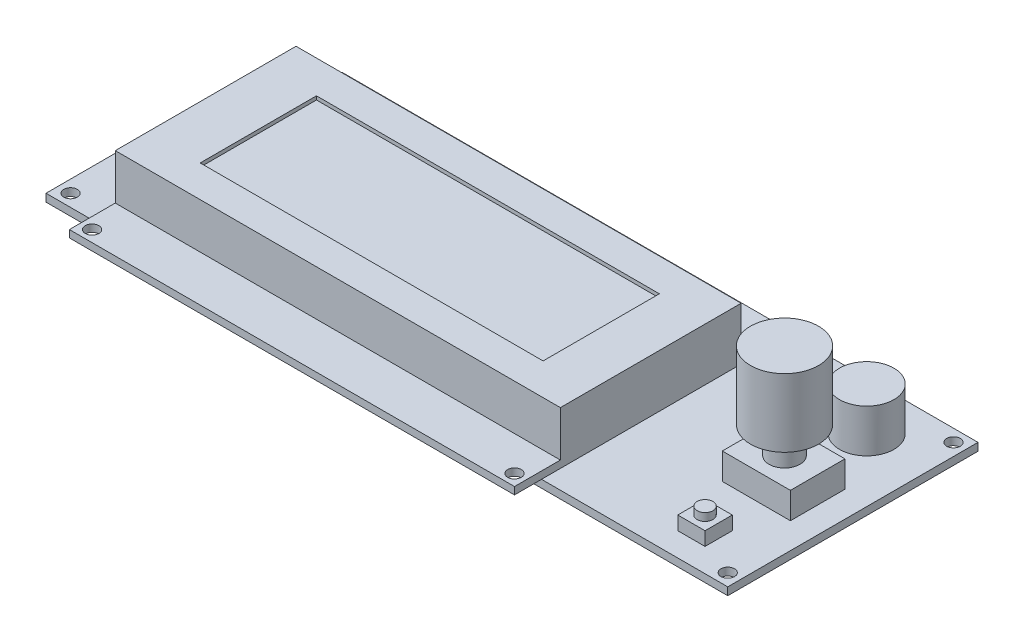
from build123d import *

# Parameters (mm, degrees)
SKETCH1_W            = 150.1
SKETCH1_H            = 55.1
SKETCH1_R            = 1.5
BOSS_EXTRUDE1_DEPTH  = 1.7
SKETCH2_W            = 40.8
SKETCH2_H            = 2.5
BOSS_EXTRUDE2_DEPTH  = 2.4
SKETCH3_W            = 98
SKETCH3_H            = 60
SKETCH3_R            = 1.5
BOSS_EXTRUDE3_DEPTH  = 1.6
SKETCH4_W            = 98
SKETCH4_H            = 39.8
BOSS_EXTRUDE4_DEPTH  = 10
SKETCH5_W            = 75.5
SKETCH5_H            = 25.6
CUT_EXTRUDE1_DEPTH   = 0.8
SKETCH6_R            = 6
BOSS_EXTRUDE5_DEPTH  = 9.5
SKETCH7_W            = 6
SKETCH7_H            = 6
BOSS_EXTRUDE6_DEPTH  = 3
SKETCH8_R            = 1.75
BOSS_EXTRUDE7_DEPTH  = 1.7
SKETCH9_W            = 26.3
SKETCH9_H            = 26.5
BOSS_EXTRUDE8_DEPTH  = 2.8
SKETCH10_W           = 20.2
SKETCH10_H           = 8.6
BOSS_EXTRUDE9_DEPTH  = 9
SKETCH11_R           = 4.65
BOSS_EXTRUDE10_DEPTH = 9
SKETCH12_W           = 15
SKETCH12_H           = 12
BOSS_EXTRUDE11_DEPTH = 5.8
SKETCH13_R           = 3.4
BOSS_EXTRUDE12_DEPTH = 5.9
SKETCH14_R           = 7.5
BOSS_EXTRUDE13_DEPTH = 15


with BuildPart() as part:
    # Sketch1 → Boss-Extrude1 (new body)
    with BuildSketch(Plane(origin=(0, 0, 0), x_dir=(1, 0, 0), z_dir=(0, 1, 0))):
        Rectangle(SKETCH1_W, SKETCH1_H)
        with Locations((-72.35, 24.85)):
            Circle(SKETCH1_R, mode=Mode.SUBTRACT)
        with Locations((-72.35, -24.85)):
            Circle(SKETCH1_R, mode=Mode.SUBTRACT)
        with Locations((72.35, 24.85)):
            Circle(SKETCH1_R, mode=Mode.SUBTRACT)
        with Locations((72.35, -24.85)):
            Circle(SKETCH1_R, mode=Mode.SUBTRACT)
    extrude(amount=BOSS_EXTRUDE1_DEPTH)

    # Sketch2 → Boss-Extrude2 (add)
    with BuildSketch(Plane(origin=(0, 1.7, 0), x_dir=(1, 0, 0), z_dir=(0, 1, 0))):
        with Locations((-32.85, 21.9)):
            Rectangle(SKETCH2_W, SKETCH2_H)
    extrude(amount=BOSS_EXTRUDE2_DEPTH)

    # Sketch3 → Boss-Extrude3 (add)
    with BuildSketch(Plane(origin=(0, 4.1, 0), x_dir=(1, 0, 0), z_dir=(0, 1, 0))):
        with Locations((-12.55, -5.9)):
            Rectangle(SKETCH3_W, SKETCH3_H)
        with Locations((-59.05, 21.6)):
            Circle(SKETCH3_R, mode=Mode.SUBTRACT)
        with Locations((33.95, 21.6)):
            Circle(SKETCH3_R, mode=Mode.SUBTRACT)
        with Locations((33.95, -33.4)):
            Circle(SKETCH3_R, mode=Mode.SUBTRACT)
        with Locations((-59.05, -33.4)):
            Circle(SKETCH3_R, mode=Mode.SUBTRACT)
    extrude(amount=BOSS_EXTRUDE3_DEPTH)

    # Sketch4 → Boss-Extrude4 (add)
    with BuildSketch(Plane(origin=(0, 5.7, 0), x_dir=(1, 0, 0), z_dir=(0, 1, 0))):
        with Locations((-12.55, -5.9)):
            Rectangle(SKETCH4_W, SKETCH4_H)
    extrude(amount=BOSS_EXTRUDE4_DEPTH)

    # Sketch5 → Cut-Extrude1 (cut)
    with BuildSketch(Plane(origin=(0, 15.7, 0), x_dir=(1, 0, 0), z_dir=(0, 1, 0))):
        with Locations((-12.1, -6)):
            Rectangle(SKETCH5_W, SKETCH5_H)
    extrude(amount=-CUT_EXTRUDE1_DEPTH, mode=Mode.SUBTRACT)

    # Sketch6 → Boss-Extrude5 (add)
    with BuildSketch(Plane(origin=(0, 1.7, 0), x_dir=(1, 0, 0), z_dir=(0, 1, 0))):
        with Locations((61.15, 16.95)):
            Circle(SKETCH6_R)
    extrude(amount=BOSS_EXTRUDE5_DEPTH)

    # Sketch7 → Boss-Extrude6 (add)
    with BuildSketch(Plane(origin=(0, 1.7, 0), x_dir=(1, 0, 0), z_dir=(0, 1, 0))):
        with Locations((61.85, -19.35)):
            Rectangle(SKETCH7_W, SKETCH7_H)
    extrude(amount=BOSS_EXTRUDE6_DEPTH)

    # Sketch8 → Boss-Extrude7 (add)
    with BuildSketch(Plane(origin=(0, 4.7, 0), x_dir=(1, 0, 0), z_dir=(0, 1, 0))):
        with Locations((61.85, -19.35)):
            Circle(SKETCH8_R)
    extrude(amount=BOSS_EXTRUDE7_DEPTH)

    # Sketch9 → Boss-Extrude8 (add)
    with BuildSketch(Plane.XZ):
        with Locations((-61.9, 6)):
            Rectangle(SKETCH9_W, SKETCH9_H)
    extrude(amount=BOSS_EXTRUDE8_DEPTH)

    # Sketch10 → Boss-Extrude9 (add)
    with BuildSketch(Plane.XZ):
        with Locations((3.95, -1.35)):
            Rectangle(SKETCH10_W, SKETCH10_H)
        with Locations((-19.05, -1.35)):
            Rectangle(SKETCH10_W, SKETCH10_H)
    extrude(amount=BOSS_EXTRUDE9_DEPTH)

    # Sketch11 → Boss-Extrude10 (add)
    with BuildSketch(Plane.XZ):
        with Locations((-62, -16.5)):
            Circle(SKETCH11_R)
    extrude(amount=BOSS_EXTRUDE10_DEPTH)

    # Sketch12 → Boss-Extrude11 (add)
    with BuildSketch(Plane(origin=(0, 1.7, 0), x_dir=(1, 0, 0), z_dir=(0, 1, 0))):
        with Locations((61.85, -2.05)):
            Rectangle(SKETCH12_W, SKETCH12_H)
    extrude(amount=BOSS_EXTRUDE11_DEPTH)

    # Sketch13 → Boss-Extrude12 (add)
    with BuildSketch(Plane(origin=(0, 7.5, 0), x_dir=(1, 0, 0), z_dir=(0, 1, 0))):
        with Locations((62.05, -2.05)):
            Circle(SKETCH13_R)
    extrude(amount=BOSS_EXTRUDE12_DEPTH)

    # Sketch14 → Boss-Extrude13 (add)
    with BuildSketch(Plane(origin=(0, 13.4, 0), x_dir=(1, 0, 0), z_dir=(0, 1, 0))):
        with Locations((62.05, -2.05)):
            Circle(SKETCH14_R)
    extrude(amount=BOSS_EXTRUDE13_DEPTH)


solid = part.part
